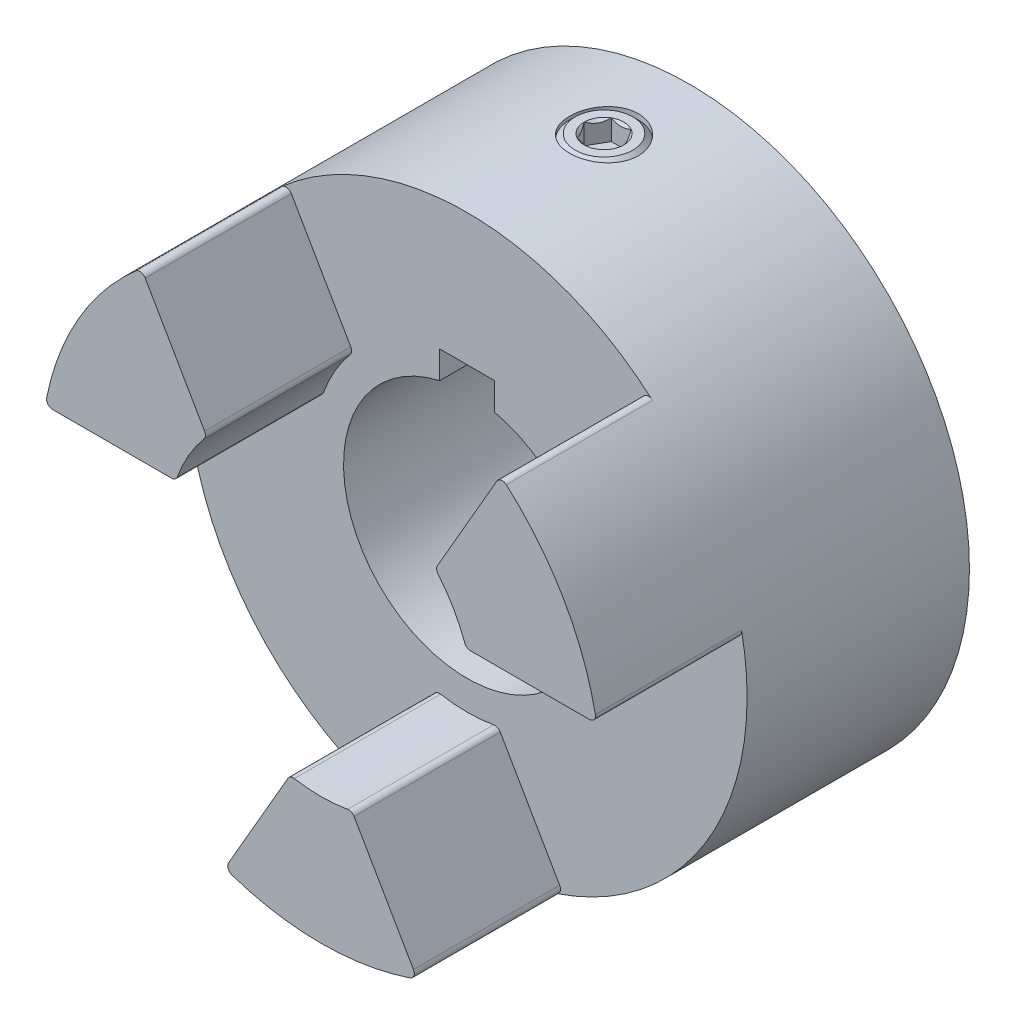
from build123d import *
from OCP.BRepFilletAPI import BRepFilletAPI_MakeChamfer

# Parameters (mm, degrees)
BOSS_EXTRUDE1_START      = -9.128125
SKETCH1_R                = 32.3453125
BOSS_EXTRUDE1_DEPTH      = 26.9875
BOSS_EXTRUDE2_DEPTH      = 16.891
FILLET1_R                = 0.713235825
CIRPATTERN1_COUNT        = 3
FILLET1_OF_CIRPATTERN1_R = 0.713235825
CUT_EXTRUDE5_DEPTH       = 59.281874117
CUT_EXTRUDE5_DEPTH_BACK  = 59.281874117
SKETCH15_R               = 14.2875
CHAMFER1_SIZE            = 1.2938125
CHAMFER1_SIZE2           = 1.918155913
CUT_EXTRUDE1_DEPTH       = 59.281874117
CUT_EXTRUDE1_DEPTH_BACK  = 59.281874117
SKETCH5_R                = 3.96875
CUT_EXTRUDE2_DEPTH       = 59.281874117
SKETCH6_R                = 3.96875
BOSS_EXTRUDE3_DEPTH      = 9.525
CUT_EXTRUDE3_DEPTH       = 2.38125
CHAMFER3_SIZE            = 0.635
CHAMFER4_SIZE            = 1.349375


with BuildPart() as part:
    # Sketch1 → Boss-Extrude1 (new body)
    with BuildSketch(Plane.XY.offset(BOSS_EXTRUDE1_START)):
        Circle(SKETCH1_R)
    extrude(amount=-BOSS_EXTRUDE1_DEPTH)

    # Sketch2 → Boss-Extrude2 (add)
    with BuildSketch(Plane.XY.offset(-9.128125)):
        with BuildLine():
            Line((-11.114350717, -30.375820135), (-3.566179127, -17.302003437))
            ThreePointArc((-3.566179127, -17.302003437), (0, -17.6657), (3.566179127, -17.302003437))
            Line((3.566179127, -17.302003437), (11.114350717, -30.375820135))
            ThreePointArc((11.114350717, -30.375820135), (0, -32.3453125), (-11.114350717, -30.375820135))
        make_face()
    boss_extrude2 = extrude(amount=BOSS_EXTRUDE2_DEPTH)

    # Fillet1
    # the kernel refuses this fillet: 0.713235825 mm, written as the material it takes off along each edge
    with BuildSketch(Plane(origin=(-11.114350717, -30.375820135, -9.128125), x_dir=(0.9436455754007305, -0.3309577435664929, 0), z_dir=(0, 0, 1))) as fillet1_piece_1:
        with BuildLine():
            CenterArc((0.860200247, 0.713171354), FILLET1_R, 169.326916929, 101.443469756)
            Line((0.159303464, 0.845266176), (0, 0))
            ThreePointArc((0, 0), (0.434894987, -0.002923796), (0.869789973, 0))
        make_face()
    extrude(amount=19.065474933, mode=Mode.SUBTRACT)
    with BuildSketch(Plane(origin=(11.114350717, -30.375820135, -9.128125), x_dir=(-0.9436455754007282, -0.3309577435664989, 0), z_dir=(0, 0, 1))) as fillet1_piece_2:
        with BuildLine():
            CenterArc((0.860200247, -0.713171354), FILLET1_R, 89.229613314, 101.443469756)
            Line((0.159303464, -0.845266176), (0, 0))
            ThreePointArc((0, 0), (0.434894987, 0.002923796), (0.869789973, 0))
        make_face()
    extrude(amount=19.065474933, mode=Mode.SUBTRACT)
    with BuildSketch(Plane(origin=(3.566179127, -17.302003437, -9.128125), x_dir=(0.500000000000002, -0.8660254037844376, 0), z_dir=(0, 0, 1))) as fillet1_piece_3:
        with BuildLine():
            CenterArc((0.507170112, -0.713235825), FILLET1_R, 90, 70.033604576)
            ThreePointArc((-0.163195289, -0.469687941), (-0.07994504, -0.235418176), (0, 0))
            Line((0, 0), (0.507170112, 0))
        make_face()
    extrude(amount=18.158925279, mode=Mode.SUBTRACT)
    with BuildSketch(Plane(origin=(-3.566179127, -17.302003437, -9.128125), x_dir=(0.9821562739684868, -0.18806661985673784, 0), z_dir=(0, 0, 1))) as fillet1_piece_4:
        with BuildLine():
            CenterArc((0.507269431, -0.71316519), FILLET1_R, 90.806371221, 70.033604577)
            Line((-0.166457119, -0.479075724), (0, 0))
            ThreePointArc((0, 0), (0.248615901, -0.001749518), (0.497231801, 0))
        make_face()
    extrude(amount=18.158925279, mode=Mode.SUBTRACT)

    # CirPattern1: Boss-Extrude2 ×3 about axis
    cirpattern1_axis = Axis((0, 0, 0), (0, 0, 1))
    for i in range(1, CIRPATTERN1_COUNT):
        add(boss_extrude2.rotate(cirpattern1_axis, i * 360 / CIRPATTERN1_COUNT))

    # Fillet1 of CirPattern1
    # the kernel refuses this fillet: 0.713235825 mm, written as the material it takes off along each edge
    with BuildSketch(Plane(origin=(31.863407256, 5.5626, -9.128125), x_dir=(-0.18520497419260348, 0.9826999122490635, 0), z_dir=(0, 0, 1)), Plane(origin=(-20.749056539, 24.813220135, -9.128125), x_dir=(-0.7584406012081224, -0.6517421686825718, 0), z_dir=(0, 0, 1))) as fillet1_of_cirpattern1_piece_1:
        with BuildLine():
            CenterArc((0.860200247, 0.713171354), FILLET1_OF_CIRPATTERN1_R, 169.326916929, 101.443469756)
            Line((0.159303464, 0.845266176), (0, 0))
            ThreePointArc((0, 0), (0.434894987, -0.002923796), (0.869789973, 0))
        make_face()
    extrude(amount=19.065474933, mode=Mode.SUBTRACT)
    with BuildSketch(Plane(origin=(20.749056539, 24.813220135, -9.128125), x_dir=(0.7584406012081266, -0.6517421686825667, 0), z_dir=(0, 0, 1)), Plane(origin=(-31.863407256, 5.5626, -9.128125), x_dir=(0.18520497419260348, 0.9826999122490635, 0), z_dir=(0, 0, 1))) as fillet1_of_cirpattern1_piece_2:
        with BuildLine():
            CenterArc((0.860200247, -0.713171354), FILLET1_OF_CIRPATTERN1_R, 89.229613314, 101.443469756)
            Line((0.159303464, -0.845266176), (0, 0))
            ThreePointArc((0, 0), (0.434894987, 0.002923796), (0.869789973, 0))
        make_face()
    extrude(amount=19.065474933, mode=Mode.SUBTRACT)
    with BuildSketch(Plane(origin=(13.200884949, 11.739403437, -9.128125), x_dir=(0.49999999999999967, 0.8660254037844388, 0), z_dir=(0, 0, 1)), Plane(origin=(-16.767064076, 5.5626, -9.128125), x_dir=(-1, 0, 0), z_dir=(0, 0, 1))) as fillet1_of_cirpattern1_piece_3:
        with BuildLine():
            CenterArc((0.507170112, -0.713235825), FILLET1_OF_CIRPATTERN1_R, 90, 70.033604576)
            ThreePointArc((-0.163195289, -0.469687941), (-0.07994504, -0.235418176), (0, 0))
            Line((0, 0), (0.507170112, 0))
        make_face()
    extrude(amount=18.158925279, mode=Mode.SUBTRACT)
    with BuildSketch(Plane(origin=(16.767064076, 5.5626, -9.128125), x_dir=(-0.3282076665844337, 0.9446055936713488, 0), z_dir=(0, 0, 1)), Plane(origin=(-13.200884949, 11.739403437, -9.128125), x_dir=(-0.6539486073840537, -0.7565389738146059, 0), z_dir=(0, 0, 1))) as fillet1_of_cirpattern1_piece_4:
        with BuildLine():
            CenterArc((0.507269431, -0.71316519), FILLET1_OF_CIRPATTERN1_R, 90.806371221, 70.033604577)
            Line((-0.166457119, -0.479075724), (0, 0))
            ThreePointArc((0, 0), (0.248615901, -0.001749518), (0.497231801, 0))
        make_face()
    extrude(amount=18.158925279, mode=Mode.SUBTRACT)

    # Sketch15 → Cut-Extrude5 (cut, two sides: drawn at the far end of the back side and taken through both)
    with BuildSketch(Plane.XY.offset(-CUT_EXTRUDE5_DEPTH_BACK)):
        Circle(SKETCH15_R)
    extrude(amount=CUT_EXTRUDE5_DEPTH + CUT_EXTRUDE5_DEPTH_BACK, mode=Mode.SUBTRACT)

    # Chamfer1: one chamfer whose edges measure the first distance from different faces: ONE call of the kernel's chamfer builder (chamfer() names one face for all edges)
    chamfer1_edges_1 = [part.edges().sort_by_distance(p)[0] for p in [
        (-32.3453125, 0, -36.115625),
    ]]
    chamfer1_side_1 = [part.faces().sort_by_distance(p)[0] for p in [
        (-32.3453125, 0, -22.621875),
    ]]
    chamfer1_edges_2 = [part.edges().sort_by_distance(p)[0] for p in [
        (-14.2875, 0, -36.115625),
    ]]
    chamfer1_side_2 = [part.faces().sort_by_distance(p)[0] for p in [
        (-14.2875, 0, -22.621875),
    ]]
    chamfer1 = BRepFilletAPI_MakeChamfer(part.part.solid().wrapped)
    for e in chamfer1_edges_1:
        chamfer1.Add(CHAMFER1_SIZE, CHAMFER1_SIZE2, e.wrapped, chamfer1_side_1[0].wrapped)  # the first distance lies on this face
    for e in chamfer1_edges_2:
        chamfer1.Add(CHAMFER1_SIZE, CHAMFER1_SIZE2, e.wrapped, chamfer1_side_2[0].wrapped)  # the first distance lies on this face
    add(Compound.cast(chamfer1.Shape()), mode=Mode.REPLACE)

    # Sketch4 → Cut-Extrude1 (cut, two sides: drawn at the far end of the back side and taken through both)
    with BuildSketch(Plane.XY.offset(-CUT_EXTRUDE1_DEPTH_BACK)):
        with BuildLine():
            Line((-3.175, 17.105255965), (3.175, 17.105255965))
            Line((3.175, 17.105255965), (3.175, 13.930255965))
            ThreePointArc((3.175, 13.930255965), (0, 14.2875), (-3.175, 13.930255965))
            Line((-3.175, 13.930255965), (-3.175, 17.105255965))
        make_face()
    extrude(amount=CUT_EXTRUDE1_DEPTH + CUT_EXTRUDE1_DEPTH_BACK, mode=Mode.SUBTRACT)

    # Sketch5 → Cut-Extrude2 (cut, through all)
    with BuildSketch(Plane(origin=(0, 0, 0), x_dir=(1, 0, 0), z_dir=(0, 1, 0))):
        with Locations(Location((0, 24.939625, 0), (0, 0, 90))):
            Circle(SKETCH5_R)
    extrude(amount=CUT_EXTRUDE2_DEPTH, mode=Mode.SUBTRACT)


with BuildPart() as body_2:
    # Sketch6 → Boss-Extrude3 (new body)
    with BuildSketch(Plane(origin=(0, 32.3453125, 0), x_dir=(-1, 0, 0), z_dir=(0, 1, 0))):
        with Locations(Location((0, -24.939625, 0), (0, 0, 90))):
            Circle(SKETCH6_R)
    extrude(amount=-BOSS_EXTRUDE3_DEPTH)

    # Sketch8 → Cut-Extrude3 (cut)
    with BuildSketch(Plane(origin=(0, 32.3453125, 0), x_dir=(1, 0, 0), z_dir=(0, 1, 0))):
        Polygon((1.14567944, 22.95525), (2.291358881, 24.939625), (1.14567944, 26.924), (-1.14567944, 26.924), (-2.291358881, 24.939625), (-1.14567944, 22.95525), align=None)
    extrude(amount=-CUT_EXTRUDE3_DEPTH, mode=Mode.SUBTRACT)

    # Cut-Extrude4 cone 1 section (through the dimple's axis) → Cut-Extrude4 (revolve, cut)
    with BuildSketch(Plane(origin=(0, 32.3453125, -24.939625), x_dir=(0, 0, 1), z_dir=(1, 0, 0))):
        Polygon((0, 0), (2.291358881, 0), (0, 2.291358881), align=None)
    revolve(axis=Axis((0, 32.3453125, -24.939625), (0, -1, 0)), mode=Mode.SUBTRACT)

    # Chamfer3
    chamfer3_edges = [body_2.edges().sort_by_distance(p)[0] for p in [
        (0, 32.3453125, -28.908375),
    ]]
    chamfer(chamfer3_edges, length=CHAMFER3_SIZE)

    # Chamfer4
    chamfer4_edges = [body_2.edges().sort_by_distance(p)[0] for p in [
        (0, 22.8203125, -28.908375),
    ]]
    chamfer(chamfer4_edges, length=CHAMFER4_SIZE)


solid = Compound([part.part, body_2.part])
